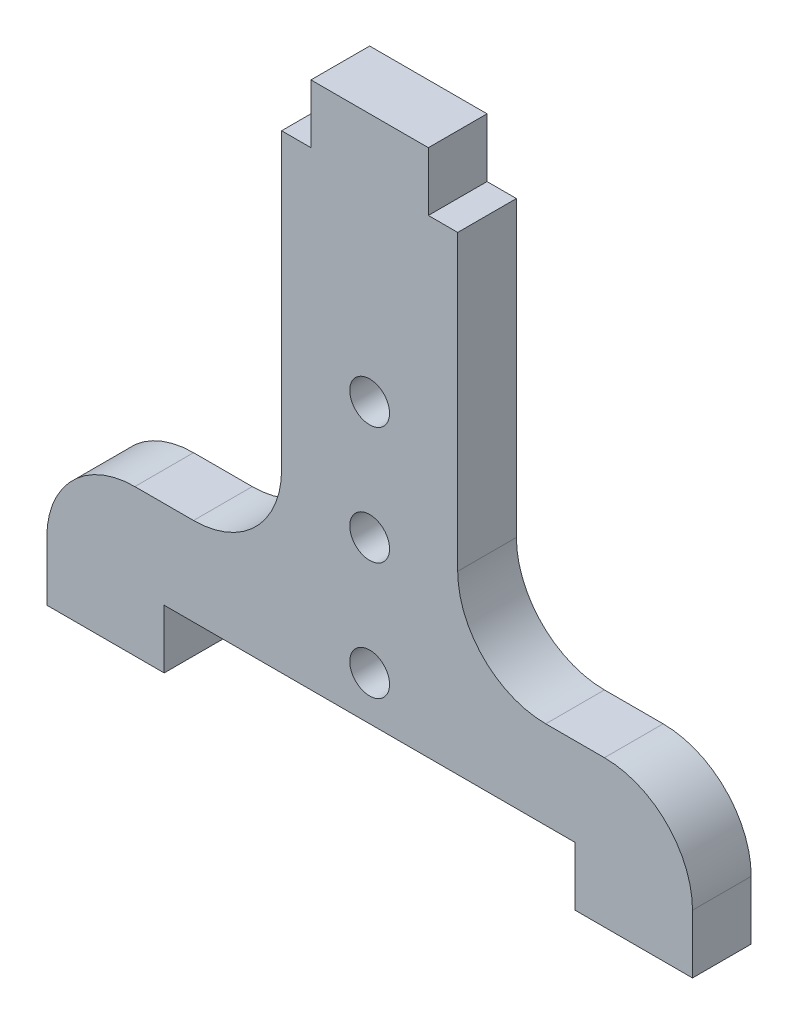
from build123d import *

# Parameters (mm, degrees)
SKETCH1_W             = 69.85
SKETCH1_H             = 50.8
BASE_DEPTH            = 6.35
SKETCH6_W             = 12.7
SKETCH6_H             = 6.35
BOSS_EXTRUDE1_DEPTH   = 6.35
SKETCH7_W             = 25.4
SKETCH7_H             = 41.275
CUT_EXTRUDE1_DEPTH    = 48.625
SKETCH8_W             = 3.175
SKETCH8_H             = 36.5125
BOSS_EXTRUDE3_DEPTH   = 6.35
F_8_CLEARANCE_HOLE1_D = 4.3053
FILLET1_R             = 9.525


with BuildPart() as part:
    # Sketch1 → Base (new body)
    with BuildSketch(Plane.XY):
        Rectangle(SKETCH1_W, SKETCH1_H)
    extrude(amount=BASE_DEPTH)

    # Sketch6 → Boss-Extrude1 (add)
    with BuildSketch(Plane.XY.offset(6.35)):
        with Locations((0, 28.575)):
            Rectangle(SKETCH6_W, SKETCH6_H)
        with Locations((28.575, -28.575)):
            Rectangle(SKETCH6_W, SKETCH6_H)
        with Locations((-28.575, -28.575)):
            Rectangle(SKETCH6_W, SKETCH6_H)
    extrude(amount=-BOSS_EXTRUDE1_DEPTH)

    # Sketch7 → Cut-Extrude1 (cut, through all)
    with BuildSketch(Plane.XY.offset(6.35)):
        with Locations((-22.225, 4.7625)):
            Rectangle(SKETCH7_W, SKETCH7_H)
        with Locations((22.225, 4.7625)):
            Rectangle(SKETCH7_W, SKETCH7_H)
    extrude(amount=-CUT_EXTRUDE1_DEPTH, mode=Mode.SUBTRACT)

    # Sketch8 → Boss-Extrude3 (add)
    with BuildSketch(Plane.XY.offset(6.35)):
        with Locations((7.9375, -7.14375)):
            Rectangle(SKETCH8_W, SKETCH8_H)
    extrude(amount=-BOSS_EXTRUDE3_DEPTH)

    # #8 Clearance Hole1 (through all)
    with Locations(Plane(origin=(0, 0, 0), x_dir=(-1, 0, 0), z_dir=(0, 0, -1))):
        with Locations((0, -20.6375), (0, -7.9375), (0, 4.7625)):
            Hole(F_8_CLEARANCE_HOLE1_D / 2)

    # Fillet1
    fillet1_edges = [part.edges().sort_by_distance(p)[0] for p in [
        (34.925, -15.875, 3.175),
        (9.525, -15.875, 3.175),
        (-9.525, -15.875, 3.175),
        (-34.925, -15.875, 3.175),
    ]]
    fillet(fillet1_edges, radius=FILLET1_R)


solid = part.part
